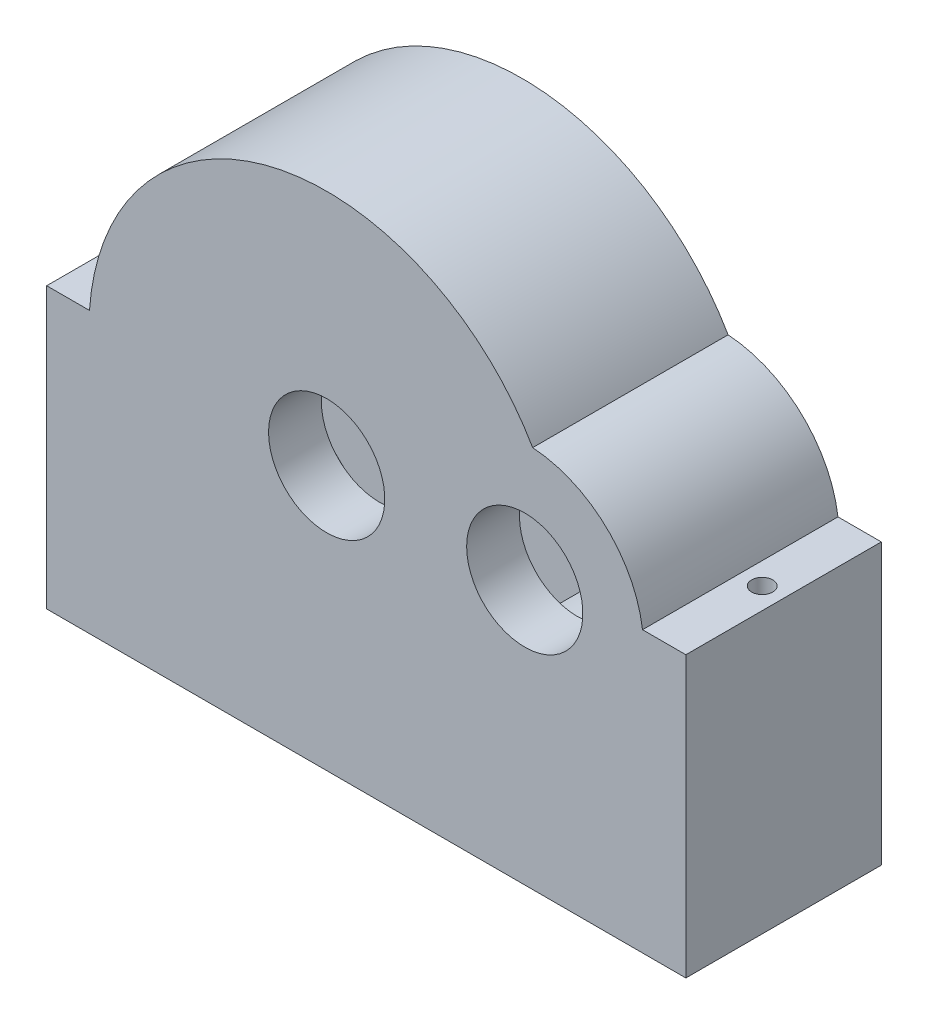
from build123d import *

# Parameters (mm, degrees)
BOSS_EXTRUDE2_DEPTH      = 27
SHELL5_DEPTH             = 17
BOSS_EXTRUDE3_START      = 10
BOSS_EXTRUDE3_DEPTH      = 10
SKETCH5_R                = 11
CUT_EXTRUDE2_DEPTH       = 87.360074687
BOSS_EXTRUDE4_DEPTH      = 37
BOSS_EXTRUDE5_DEPTH      = 3
BOSS_EXTRUDE5_DEPTH_BACK = 50
SKETCH10_R               = 2
CUT_EXTRUDE3_DEPTH       = 10


# Read off the part's stored shape, not the designer's step: Shell5
with BuildPart() as part:
    # Sketch1 → Boss-Extrude2 (new body)
    with BuildSketch(Plane.XY):
        with BuildLine():
            ThreePointArc((20.25, 22.449944321), (-63.75, 0), (20.25, -22.449944321))
            ThreePointArc((20.25, -22.449944321), (41.25, 0), (20.25, 22.449944321))
        make_face()
    extrude(amount=BOSS_EXTRUDE2_DEPTH)

    # Shell5 outline → Shell5 (cut)
    with BuildSketch(Plane.XY):
        with BuildLine():
            ThreePointArc((14.25, -11.66190379), (31.25, 0), (14.25, 11.66190379))
            ThreePointArc((14.25, 11.66190379), (-53.75, 0), (14.25, -11.66190379))
        make_face()
    extrude(amount=SHELL5_DEPTH, mode=Mode.SUBTRACT)

    # Sketch4 → Boss-Extrude3 (add)
    with BuildSketch(Plane(origin=(0, 0, 0), x_dir=(-1, 0, 0), z_dir=(0, 0, -1)).offset(BOSS_EXTRUDE3_START)):
        with BuildLine():
            ThreePointArc((-20.25, 22.449944321), (-41.25, 0), (-20.25, -22.449944321))
            ThreePointArc((-20.25, -22.449944321), (63.75, 0), (-20.25, 22.449944321))
        make_face()
    extrude(amount=-BOSS_EXTRUDE3_DEPTH)

    # Sketch5 → Cut-Extrude2 (cut, through all)
    with BuildSketch(Plane(origin=(0, 0, -10), x_dir=(-1, 0, 0), z_dir=(0, 0, -1))):
        with Locations((-18.75, 0)):
            Circle(SKETCH5_R)
        with Locations((18.75, 0)):
            Circle(SKETCH5_R)
    extrude(amount=-CUT_EXTRUDE2_DEPTH, mode=Mode.SUBTRACT)

    # Sketch8 → Boss-Extrude4 (add)
    with BuildSketch(Plane(origin=(0, 0, -10), x_dir=(-1, 0, 0), z_dir=(0, 0, -1))):
        with BuildLine():
            Line((-41.25, 0), (-41.25, -50))
            Line((-41.25, -50), (63.75, -50))
            Line((63.75, -50), (63.75, 0))
            ThreePointArc((63.75, 0), (30.368950039, -43.474130239), (-20.25, -22.449944321))
            ThreePointArc((-20.25, -22.449944321), (-35.181676725, -15.370426149), (-41.25, 0))
        make_face()
    extrude(amount=-BOSS_EXTRUDE4_DEPTH)

    # Sketch9 → Boss-Extrude5 (add, two sides: drawn at the far end of the back side and taken through both)
    with BuildSketch(Plane(origin=(0, 0, 0), x_dir=(1, 0, 0), z_dir=(0, 1, 0)).offset(-BOSS_EXTRUDE5_DEPTH_BACK)):
        Polygon((-71.75, -27), (-58.75, -27), (-58.75, -8.5), (-58.75, 10), (-71.75, 10), align=None)
        Polygon((36.25, -8.5), (36.25, 10), (49.25, 10), (49.25, -27), (36.25, -27), align=None)
    extrude(amount=BOSS_EXTRUDE5_DEPTH + BOSS_EXTRUDE5_DEPTH_BACK)

    # Sketch10 → Cut-Extrude3 (cut)
    with BuildSketch(Plane(origin=(0, 3, 0), x_dir=(1, 0, 0), z_dir=(0, 1, 0))):
        with Locations(Location((-67.699944321, -8.5, 0), (0, 0, 270))):
            Circle(SKETCH10_R)
        with Locations(Location((45.199944321, -8.5, 0), (0, 0, 90))):
            Circle(SKETCH10_R)
    extrude(amount=-CUT_EXTRUDE3_DEPTH, mode=Mode.SUBTRACT)


solid = part.part
